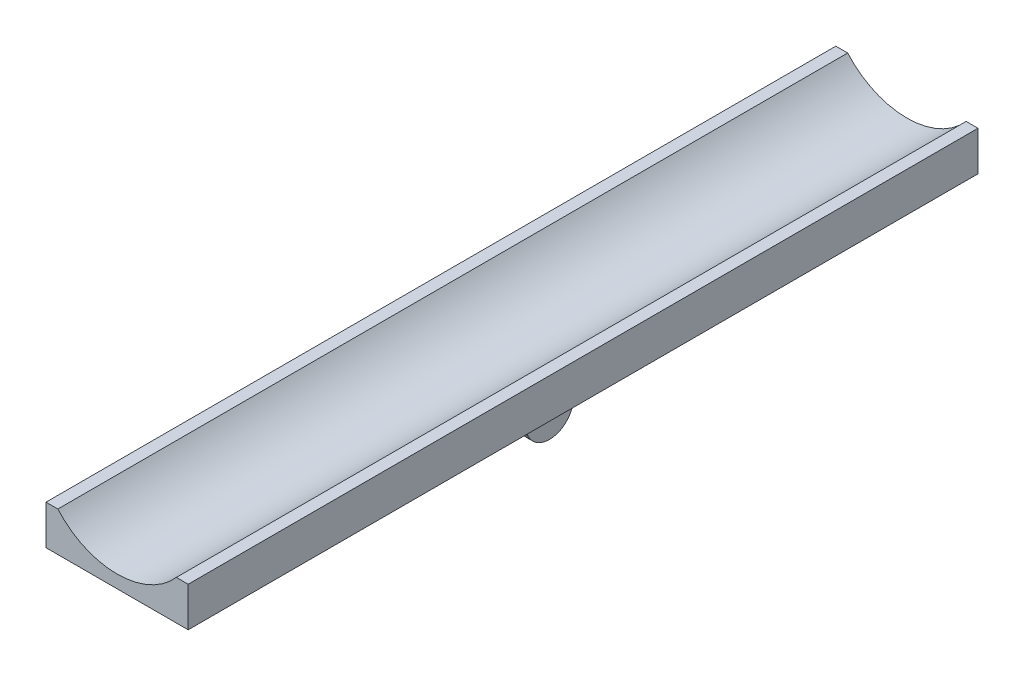
from build123d import *

# Parameters (mm, degrees)
THICKEN1_START           = -92.5
THICKEN1_OUTLINE_W       = 30
THICKEN1_OUTLINE_H       = 4.5
THICKEN1_DEPTH           = 185
THICKEN2_START           = -92.5
THICKEN2_OUTLINE_W       = 3
THICKEN2_OUTLINE_H       = 18
THICKEN2_DEPTH           = 185
THICKEN3_START           = -92.5
THICKEN3_OUTLINE_W       = 3
THICKEN3_OUTLINE_H       = 18
THICKEN3_DEPTH           = 185
BOSS_EXTRUDE1_DEPTH      = 185
SKETCH7_W                = 36
SKETCH7_H                = 8
CUT_EXTRUDE1_DEPTH       = 187.604528348
BOSS_EXTRUDE2_DEPTH      = 7.5
BOSS_EXTRUDE3_START      = 7.5
BOSS_EXTRUDE3_DEPTH      = 7.5
BOSS_EXTRUDE4_DEPTH      = 9.5
BOSS_EXTRUDE4_DEPTH_BACK = 9.5
SKETCH10_R               = 6
SKETCH10_R_2             = 2
BOSS_EXTRUDE5_DEPTH      = 3
BOSS_EXTRUDE5_DEPTH_BACK = 3
SKETCH11_R               = 6
SKETCH11_R_2             = 2


# Read off the part's stored shape, not the designer's step: Thicken1, Thicken2, Thicken3
with BuildPart() as part:
    # Thicken1 outline → Thicken1 (new body)
    with BuildSketch(Plane.XY.offset(THICKEN1_START)):
        with Locations((0, 0.75)):
            Rectangle(THICKEN1_OUTLINE_W, THICKEN1_OUTLINE_H)
    extrude(amount=THICKEN1_DEPTH)

    # Thicken2 outline → Thicken2 (add)
    with BuildSketch(Plane.XY.offset(THICKEN2_START)):
        with Locations((16.5, 7.5)):
            Rectangle(THICKEN2_OUTLINE_W, THICKEN2_OUTLINE_H)
    extrude(amount=THICKEN2_DEPTH)

    # Thicken3 outline → Thicken3 (add)
    with BuildSketch(Plane.XY.offset(THICKEN3_START)):
        with Locations((-16.5, 7.5)):
            Rectangle(THICKEN3_OUTLINE_W, THICKEN3_OUTLINE_H)
    extrude(amount=THICKEN3_DEPTH)

    # Sketch4 → Boss-Extrude1 (add)
    with BuildSketch(Plane.XY.offset(92.5)):
        with BuildLine():
            Line((-15, 16.5), (-15, 3))
            Line((-15, 3), (15, 3))
            Line((15, 3), (15, 16.5))
            ThreePointArc((15, 16.5), (0, 9.728756555), (-15, 16.5))
        make_face()
    extrude(amount=-BOSS_EXTRUDE1_DEPTH)

    # Sketch7 → Cut-Extrude1 (cut, through all)
    with BuildSketch(Plane(origin=(0, 0, -92.5), x_dir=(-1, 0, 0), z_dir=(0, 0, -1))):
        with Locations((0, 2.5)):
            Rectangle(SKETCH7_W, SKETCH7_H)
    extrude(amount=-CUT_EXTRUDE1_DEPTH, mode=Mode.SUBTRACT)

    # Sketch8 → Boss-Extrude2 (add)
    with BuildSketch(Plane(origin=(0, 0, -92.5), x_dir=(-1, 0, 0), z_dir=(0, 0, -1))):
        with BuildLine():
            Line((-18, 6.5), (18, 6.5))
            Line((18, 6.5), (18, 16.5))
            Line((18, 16.5), (15, 16.5))
            ThreePointArc((15, 16.5), (0, 9.728756555), (-15, 16.5))
            Line((-15, 16.5), (-18, 16.5))
            Line((-18, 16.5), (-18, 6.5))
        make_face()
    extrude(amount=BOSS_EXTRUDE2_DEPTH)

    # Sketch9 → Boss-Extrude3 (add)
    with BuildSketch(Plane.XY.offset(92.5).offset(BOSS_EXTRUDE3_START)):
        with BuildLine():
            Line((-18, 6.5), (18, 6.5))
            Line((18, 6.5), (18, 16.5))
            Line((18, 16.5), (15, 16.5))
            ThreePointArc((15, 16.5), (0, 9.728756555), (-15, 16.5))
            Line((-15, 16.5), (-18, 16.5))
            Line((-18, 16.5), (-18, 6.5))
        make_face()
    extrude(amount=-BOSS_EXTRUDE3_DEPTH)

    # Sketch10 → Boss-Extrude4 (add, two sides: drawn at the far end of the back side and taken through both)
    # profile 1 of 2: a face of its own
    with BuildSketch(Plane(origin=(0, 0, 0), x_dir=(0, 0, -1), z_dir=(1, 0, 0)).offset(-BOSS_EXTRUDE4_DEPTH_BACK)):
        Circle(SKETCH10_R)
        Circle(SKETCH10_R_2, mode=Mode.SUBTRACT)
    # profile 2 of 2: a face of its own
    with BuildSketch(Plane(origin=(0, 0, 0), x_dir=(0, 0, -1), z_dir=(1, 0, 0)).offset(-BOSS_EXTRUDE4_DEPTH_BACK)):
        with BuildLine():
            Line((10, 6.5), (-10, 6.5))
            Line((-10, 6.5), (-5.35678593, -2.702747584))
            ThreePointArc((-5.35678593, -2.702747584), (-1.389115622, 5.836981908), (6, 0))
            ThreePointArc((6, 0), (5.836981908, -1.389115622), (5.35678593, -2.702747584))
            Line((5.35678593, -2.702747584), (10, 6.5))
        make_face()
    extrude(amount=BOSS_EXTRUDE4_DEPTH + BOSS_EXTRUDE4_DEPTH_BACK)

    # Sketch11 → Boss-Extrude5 (add, two sides: drawn at the far end of the back side and taken through both)
    # profile 1 of 2: a face of its own
    with BuildSketch(Plane(origin=(0, 0, 0), x_dir=(0, 0, -1), z_dir=(1, 0, 0)).offset(-BOSS_EXTRUDE5_DEPTH_BACK)):
        with Locations((92.5, 0)):
            Circle(SKETCH11_R)
        with Locations(Location((92.5, 0, 0), (0, 0, 90))):
            Circle(SKETCH11_R_2, mode=Mode.SUBTRACT)
    # profile 2 of 2: a face of its own
    with BuildSketch(Plane(origin=(0, 0, 0), x_dir=(0, 0, -1), z_dir=(1, 0, 0)).offset(-BOSS_EXTRUDE5_DEPTH_BACK)):
        with BuildLine():
            ThreePointArc((86.5, 0), (92.5, 6), (98.5, 0))
            Line((98.5, 0), (98.5, 6.5))
            Line((98.5, 6.5), (86.5, 6.5))
            Line((86.5, 6.5), (86.5, 0))
        make_face()
    extrude(amount=BOSS_EXTRUDE5_DEPTH + BOSS_EXTRUDE5_DEPTH_BACK)


solid = part.part
